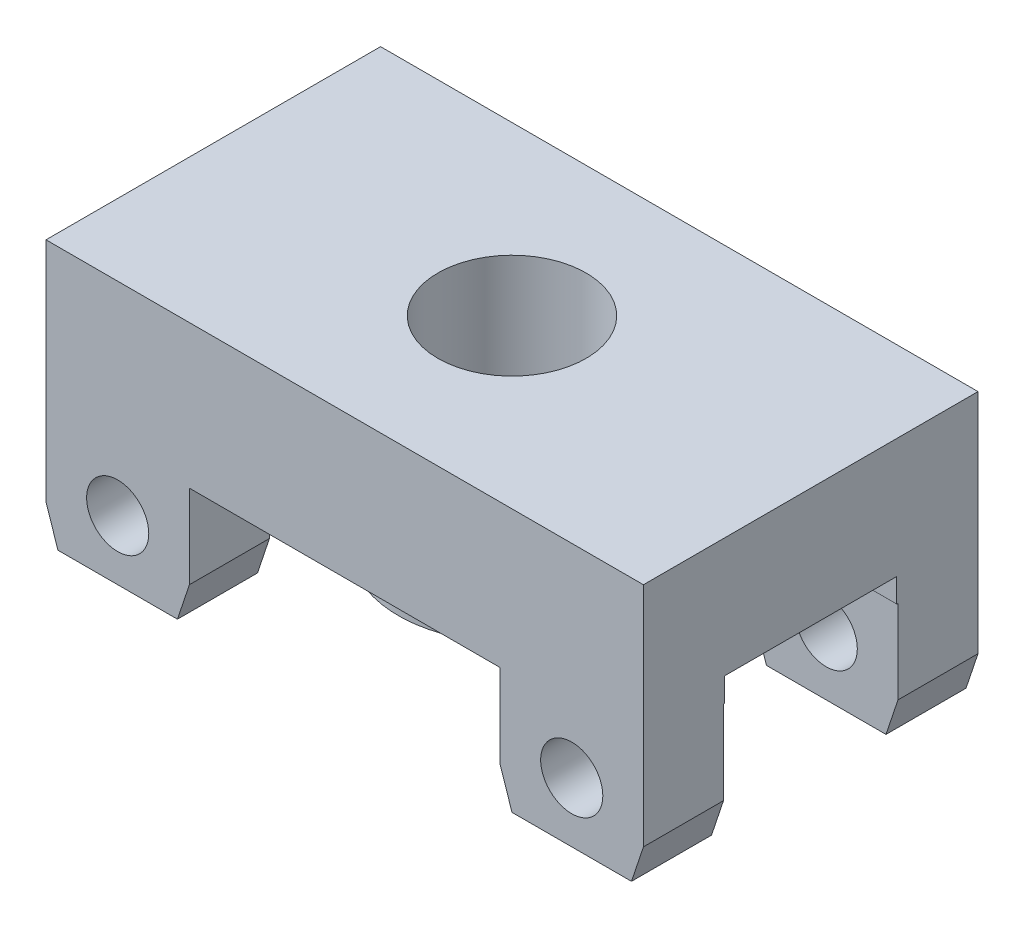
from build123d import *

# Parameters (mm, degrees)
SKETCH_1_W                 = 50
SKETCH_1_H                 = 12
UPPER_CROSSBAR_DEPTH       = 28
SKETCH_2_R                 = 9.5
LOWER_GUIDE_SLEEVE_DEPTH   = 5
SKETCH_3_R                 = 6.2
SPINDLE_THROUGH_BORE_DEPTH = 60.774576536
UPPER_HINGE_EAR_DEPTH      = 6.7
SKETCH_6_R                 = 2.6
UPPER_HINGE_BORE_DEPTH     = 59.549124673
EXTRUDE_2_DEPTH            = 6.7
SKETCH_8_R                 = 2.6
CUT_EXTRUDE_2_DEPTH        = 59.549124673
OPPOSITE_HINGE_EAR_DEPTH   = 6.7
SKETCH_10_R                = 2.6
OPPOSITE_HINGE_BORE_DEPTH  = 59.549124673
EXTRUDE_4_DEPTH            = 6.7
SKETCH_12_R                = 2.6
CUT_EXTRUDE_4_DEPTH        = 59.549124673
SKETCH_14_W                = 20
SKETCH_14_H                = 2.2
ARM_SWING_CLEARANCE_DEPTH  = 7.2
SKETCH_15_W                = 20
SKETCH_15_H                = 2.2
CUT_EXTRUDE_6_DEPTH        = 7.2


with BuildPart() as part:
    # 草图1 → Upper_crossbar (new body)
    with BuildSketch(Plane.XY):
        with Locations((25, 6)):
            Rectangle(SKETCH_1_W, SKETCH_1_H)
    extrude(amount=UPPER_CROSSBAR_DEPTH)

    # 草图2 → Lower_guide_sleeve (add)
    with BuildSketch(Plane.XZ):
        with Locations((25, 14)):
            Circle(SKETCH_2_R)
    extrude(amount=LOWER_GUIDE_SLEEVE_DEPTH)

    # 草图3 → Spindle_through_bore (cut, through all)
    with BuildSketch(Plane(origin=(0, 12, 0), x_dir=(1, 0, 0), z_dir=(0, 1, 0))):
        with Locations((25, -14)):
            Circle(SKETCH_3_R)
    extrude(amount=-SPINDLE_THROUGH_BORE_DEPTH, mode=Mode.SUBTRACT)

    # 草图5 → Upper_hinge_ear (add)
    with BuildSketch(Plane.XY.offset(21.3)):
        Polygon((1, -10), (11, -10), (12, -7), (12, 1), (0, 1), (0, -7), align=None)
    extrude(amount=UPPER_HINGE_EAR_DEPTH)

    # 草图6 → Upper_hinge_bore (cut, through all)
    with BuildSketch(Plane.XY.offset(28)):
        with Locations((6, -5)):
            Circle(SKETCH_6_R)
    extrude(amount=-UPPER_HINGE_BORE_DEPTH, mode=Mode.SUBTRACT)

    # 草图7 → 凸台-拉伸2 (add)
    with BuildSketch(Plane.XY.offset(21.3)):
        Polygon((39, -10), (49, -10), (50, -7), (50, 1), (38, 1), (38, -7), align=None)
    extrude(amount=EXTRUDE_2_DEPTH)

    # 草图8 → 切除-拉伸2 (cut, through all)
    with BuildSketch(Plane.XY.offset(28)):
        with Locations((44, -5)):
            Circle(SKETCH_8_R)
    extrude(amount=-CUT_EXTRUDE_2_DEPTH, mode=Mode.SUBTRACT)

    # 草图9 → Opposite_hinge_ear (add)
    with BuildSketch(Plane.XY):
        Polygon((1, -10), (11, -10), (12, -7), (12, 1), (0, 1), (0, -7), align=None)
    extrude(amount=OPPOSITE_HINGE_EAR_DEPTH)

    # 草图10 → Opposite_hinge_bore (cut, through all)
    with BuildSketch(Plane(origin=(0, 0, 0), x_dir=(-1, 0, 0), z_dir=(0, 0, -1))):
        with Locations((-6, -5)):
            Circle(SKETCH_10_R)
    extrude(amount=-OPPOSITE_HINGE_BORE_DEPTH, mode=Mode.SUBTRACT)

    # 草图11 → 凸台-拉伸4 (add)
    with BuildSketch(Plane.XY):
        Polygon((39, -10), (49, -10), (50, -7), (50, 1), (38, 1), (38, -7), align=None)
    extrude(amount=EXTRUDE_4_DEPTH)

    # 草图12 → 切除-拉伸4 (cut, through all)
    with BuildSketch(Plane(origin=(0, 0, 0), x_dir=(-1, 0, 0), z_dir=(0, 0, -1))):
        with Locations((-44, -5)):
            Circle(SKETCH_12_R)
    extrude(amount=-CUT_EXTRUDE_4_DEPTH, mode=Mode.SUBTRACT)

    # 草图14 → Arm_swing_clearance (cut, symmetric)
    with BuildSketch(Plane.XY.offset(14)):
        with Locations((8, 0.9)):
            Rectangle(SKETCH_14_W, SKETCH_14_H)
    extrude(amount=ARM_SWING_CLEARANCE_DEPTH, both=True, mode=Mode.SUBTRACT)

    # 草图15 → 切除-拉伸6 (cut, symmetric)
    with BuildSketch(Plane.XY.offset(14)):
        with Locations((42, 0.9)):
            Rectangle(SKETCH_15_W, SKETCH_15_H)
    extrude(amount=CUT_EXTRUDE_6_DEPTH, both=True, mode=Mode.SUBTRACT)


solid = part.part
